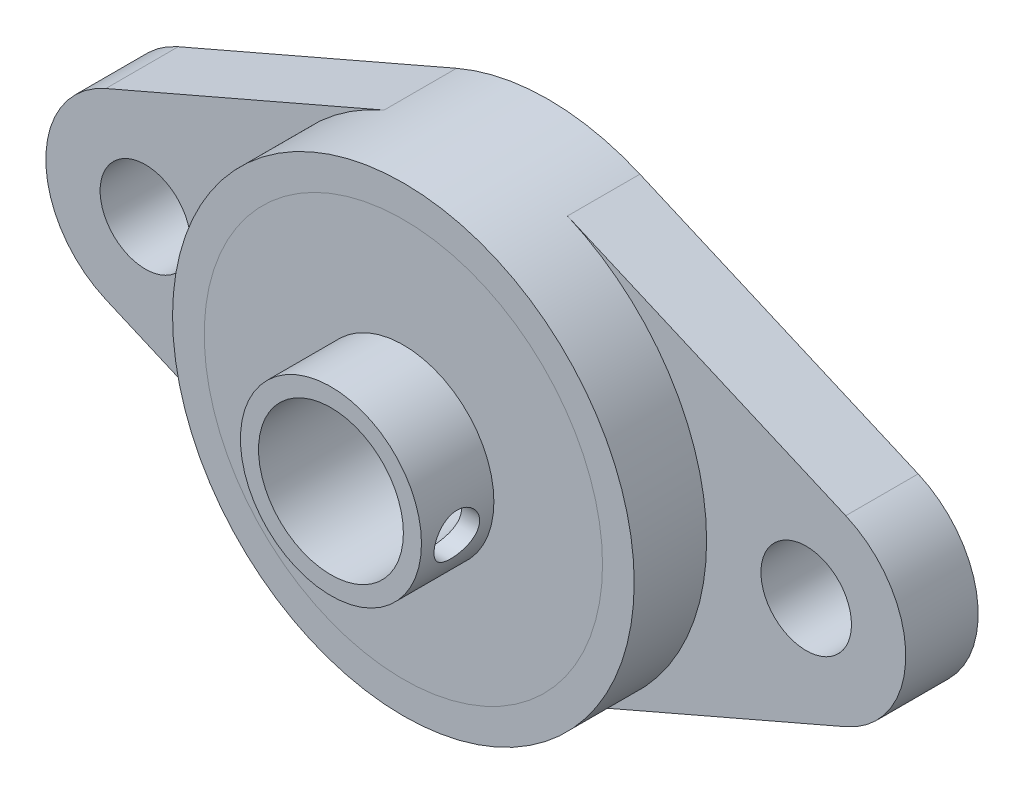
from build123d import *

# Parameters (mm, degrees)
CROQUIS1_R              = 5
CROQUIS1_R_2            = 2.5
SALIENTE_EXTRUIR1_DEPTH = 4
CROQUIS2_R              = 12.75
CROQUIS2_R_2            = 11
SALIENTE_EXTRUIR2_DEPTH = 4
CROQUIS3_R              = 11
CROQUIS3_R_2            = 5
SALIENTE_EXTRUIR3_DEPTH = 4
CROQUIS5_R              = 5
CROQUIS5_R_2            = 4
SALIENTE_EXTRUIR4_DEPTH = 12


with BuildPart() as part:
    # Croquis1 → Saliente-Extruir1 (new body)
    with BuildSketch(Plane.XY):
        with BuildLine():
            Line((-20.434931507, -5.047382917), (-5.065068493, -11.700751307))
            ThreePointArc((-5.065068493, -11.700751307), (0, -12.75), (5.065068493, -11.700751307))
            Line((5.065068493, -11.700751307), (20.434931507, -5.047382917))
            ThreePointArc((20.434931507, -5.047382917), (23.75, 0), (20.434931507, 5.047382917))
            Line((20.434931507, 5.047382917), (5.065068493, 11.700751307))
            ThreePointArc((5.065068493, 11.700751307), (0, 12.75), (-5.065068493, 11.700751307))
            Line((-5.065068493, 11.700751307), (-20.434931507, 5.047382917))
            ThreePointArc((-20.434931507, 5.047382917), (-23.75, 0), (-20.434931507, -5.047382917))
        make_face()
        Circle(CROQUIS1_R, mode=Mode.SUBTRACT)
        with Locations((-18.25, 0)):
            Circle(CROQUIS1_R_2, mode=Mode.SUBTRACT)
        with Locations((18.25, 0)):
            Circle(CROQUIS1_R_2, mode=Mode.SUBTRACT)
    extrude(amount=SALIENTE_EXTRUIR1_DEPTH)

    # Croquis2 → Saliente-Extruir2 (add)
    with BuildSketch(Plane.XY.offset(4)):
        Circle(CROQUIS2_R)
        Circle(CROQUIS2_R_2, mode=Mode.SUBTRACT)
    extrude(amount=SALIENTE_EXTRUIR2_DEPTH)


with BuildPart() as body_2:
    # Croquis3 → Saliente-Extruir3 (new body)
    with BuildSketch(Plane.XY.offset(4)):
        Circle(CROQUIS3_R)
        Circle(CROQUIS3_R_2, mode=Mode.SUBTRACT)
    extrude(amount=SALIENTE_EXTRUIR3_DEPTH)


with BuildPart() as body_3:
    # Croquis5 → Saliente-Extruir4 (new body)
    with BuildSketch(Plane.XY):
        Circle(CROQUIS5_R)
        Circle(CROQUIS5_R_2, mode=Mode.SUBTRACT)
    extrude(amount=SALIENTE_EXTRUIR4_DEPTH)


with BuildPart() as body_2_1:
    add(body_2.part)

    # Combinar1: union body 3
    add(body_3.part)

    # Sketch2 → M3 Tapped Hole1 (revolve, cut)
    with BuildSketch(Plane(origin=(5, -0.671278383, 10), x_dir=(0, 0, -1), z_dir=(0, 1, 0))):
        Polygon((0, 0), (0, 6.251075774), (1.25, 5.5), (1.25, 0), align=None)
    revolve(axis=Axis((11.35, -0.671278383, 10), (-1, 0, 0)), mode=Mode.SUBTRACT)


solid = Compound([part.part, body_2_1.part])
